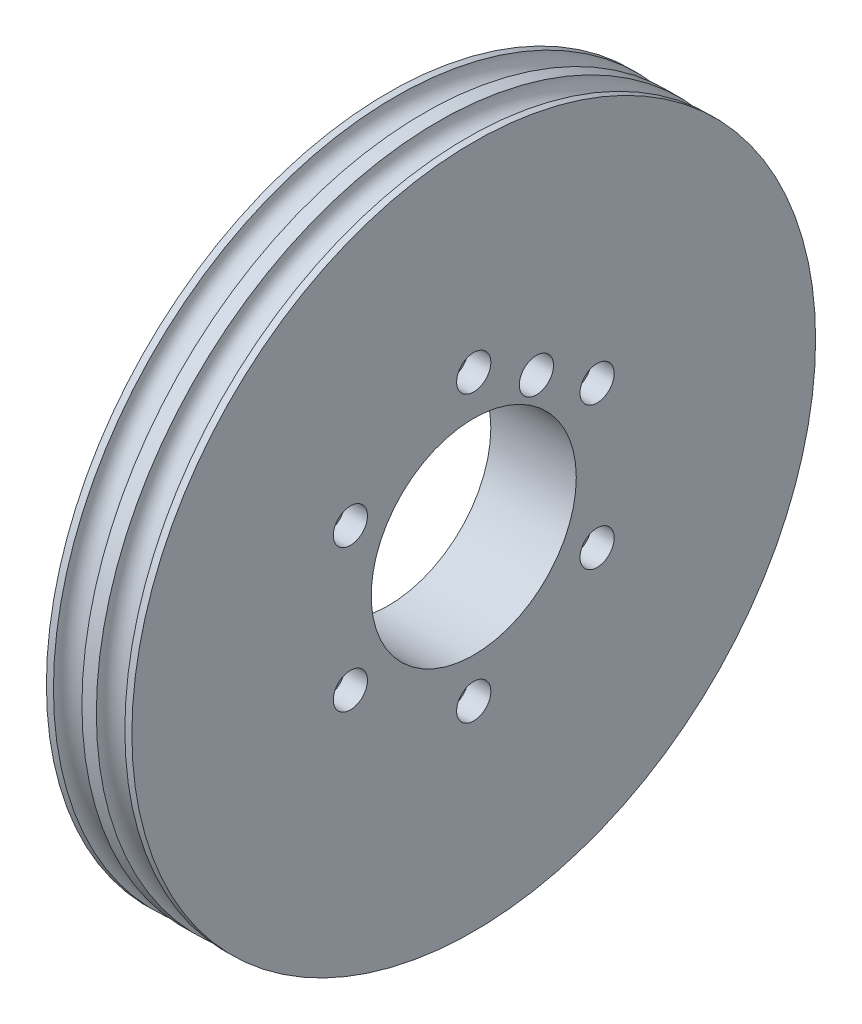
from build123d import *

# Parameters (mm, degrees)
SKETCH1_R           = 60
SKETCH1_R_2         = 18
BOSS_EXTRUDE1_DEPTH = 7.5
CUT_EXTRUDE2_REACH  = 88.168
SKETCH3_R           = 2
SKETCH4_R           = 33
SKETCH4_R_2         = 30
CUT_EXTRUDE3_DEPTH  = 3
SKETCH5_R           = 2.5
SKETCH6_R           = 3
CUT_EXTRUDE4_DEPTH  = 4
CUT_EXTRUDE5_REACH  = 88.168
SKETCH7_R           = 3


with BuildPart() as part:
    # Sketch1 → Boss-Extrude1 (new, symmetric)
    with BuildSketch(Plane(origin=(0, 0, 0), x_dir=(0, 0, -1), z_dir=(1, 0, 0))):
        Circle(SKETCH1_R)
        Circle(SKETCH1_R_2, mode=Mode.SUBTRACT)
    extrude(amount=BOSS_EXTRUDE1_DEPTH, both=True)

    # Sketch3 → Cut-Extrude2 (cut, up to next)
    with BuildSketch(Plane(origin=(7.5, 0, 0), x_dir=(0, 0, -1), z_dir=(1, 0, 0)), mode=Mode.PRIVATE) as cut_extrude2_sk1:
        with Locations((0, 25)):
            Circle(SKETCH3_R)
    cut_extrude2_tool1 = extrude(cut_extrude2_sk1.sketch, amount=-CUT_EXTRUDE2_REACH, mode=Mode.PRIVATE) & part.part
    # Sketch3 → Cut-Extrude2 (cut, up to next)
    with BuildSketch(Plane(origin=(7.5, 0, 0), x_dir=(0, 0, -1), z_dir=(1, 0, 0)), mode=Mode.PRIVATE) as cut_extrude2_sk2:
        with Locations((21.650635095, 12.5)):
            Circle(SKETCH3_R)
    cut_extrude2_tool2 = extrude(cut_extrude2_sk2.sketch, amount=-CUT_EXTRUDE2_REACH, mode=Mode.PRIVATE) & part.part
    # Sketch3 → Cut-Extrude2 (cut, up to next)
    with BuildSketch(Plane(origin=(7.5, 0, 0), x_dir=(0, 0, -1), z_dir=(1, 0, 0)), mode=Mode.PRIVATE) as cut_extrude2_sk3:
        with Locations((21.650635095, -12.5)):
            Circle(SKETCH3_R)
    cut_extrude2_tool3 = extrude(cut_extrude2_sk3.sketch, amount=-CUT_EXTRUDE2_REACH, mode=Mode.PRIVATE) & part.part
    # Sketch3 → Cut-Extrude2 (cut, up to next)
    with BuildSketch(Plane(origin=(7.5, 0, 0), x_dir=(0, 0, -1), z_dir=(1, 0, 0)), mode=Mode.PRIVATE) as cut_extrude2_sk4:
        with Locations((0, -25)):
            Circle(SKETCH3_R)
    cut_extrude2_tool4 = extrude(cut_extrude2_sk4.sketch, amount=-CUT_EXTRUDE2_REACH, mode=Mode.PRIVATE) & part.part
    # Sketch3 → Cut-Extrude2 (cut, up to next)
    with BuildSketch(Plane(origin=(7.5, 0, 0), x_dir=(0, 0, -1), z_dir=(1, 0, 0)), mode=Mode.PRIVATE) as cut_extrude2_sk5:
        with Locations((-21.650635095, -12.5)):
            Circle(SKETCH3_R)
    cut_extrude2_tool5 = extrude(cut_extrude2_sk5.sketch, amount=-CUT_EXTRUDE2_REACH, mode=Mode.PRIVATE) & part.part
    # Sketch3 → Cut-Extrude2 (cut, up to next)
    with BuildSketch(Plane(origin=(7.5, 0, 0), x_dir=(0, 0, -1), z_dir=(1, 0, 0)), mode=Mode.PRIVATE) as cut_extrude2_sk6:
        with Locations((-21.650635095, 12.5)):
            Circle(SKETCH3_R)
    cut_extrude2_tool6 = extrude(cut_extrude2_sk6.sketch, amount=-CUT_EXTRUDE2_REACH, mode=Mode.PRIVATE) & part.part
    add(cut_extrude2_tool1.solids().sort_by_distance((7.5, 25, 0))[0], mode=Mode.SUBTRACT)
    add(cut_extrude2_tool2.solids().sort_by_distance((7.5, 12.5, -21.650635))[0], mode=Mode.SUBTRACT)
    add(cut_extrude2_tool3.solids().sort_by_distance((7.5, -12.5, -21.650635))[0], mode=Mode.SUBTRACT)
    add(cut_extrude2_tool4.solids().sort_by_distance((7.5, -25, 0))[0], mode=Mode.SUBTRACT)
    add(cut_extrude2_tool5.solids().sort_by_distance((7.5, -12.5, 21.650635))[0], mode=Mode.SUBTRACT)
    add(cut_extrude2_tool6.solids().sort_by_distance((7.5, 12.5, 21.650635))[0], mode=Mode.SUBTRACT)

    # Sketch4 → Cut-Extrude3 (cut)
    with BuildSketch(Plane.ZY.offset(7.5)):
        Circle(SKETCH4_R)
        Circle(SKETCH4_R_2, mode=Mode.SUBTRACT)
    extrude(amount=-CUT_EXTRUDE3_DEPTH, mode=Mode.SUBTRACT)

    # Sketch5 → Cut-Revolve2 (revolve, cut)
    with BuildSketch(Plane.XY):
        with Locations((3.766886577, 60.013835775)):
            Circle(SKETCH5_R)
        with Locations((-3.766886577, 60.013835775)):
            Circle(SKETCH5_R)
    revolve(axis=Axis((7.5, 0, 0), (-1, 0, 0)), mode=Mode.SUBTRACT)

    # Sketch6 → Cut-Extrude4 (cut)
    with BuildSketch(Plane(origin=(7.5, 0, 0), x_dir=(0, 0, -1), z_dir=(1, 0, 0))):
        with Locations((0, 25)):
            Circle(SKETCH6_R)
        with Locations((21.650635095, 12.5)):
            Circle(SKETCH6_R)
        with Locations((21.650635095, -12.5)):
            Circle(SKETCH6_R)
        with Locations((0, -25)):
            Circle(SKETCH6_R)
        with Locations((-21.650635095, -12.5)):
            Circle(SKETCH6_R)
        with Locations((-21.650635095, 12.5)):
            Circle(SKETCH6_R)
    extrude(amount=-CUT_EXTRUDE4_DEPTH, mode=Mode.SUBTRACT)

    # Sketch7 → Cut-Extrude5 (cut, up to next)
    with BuildSketch(Plane.ZY.offset(7.5), mode=Mode.PRIVATE) as cut_extrude5_sk1:
        with Locations((-11, 19.052558883)):
            Circle(SKETCH7_R)
    cut_extrude5_tool1 = extrude(cut_extrude5_sk1.sketch, amount=-CUT_EXTRUDE5_REACH, mode=Mode.PRIVATE) & part.part
    add(cut_extrude5_tool1.solids().sort_by_distance((-7.5, 19.052559, -11))[0], mode=Mode.SUBTRACT)


solid = part.part
